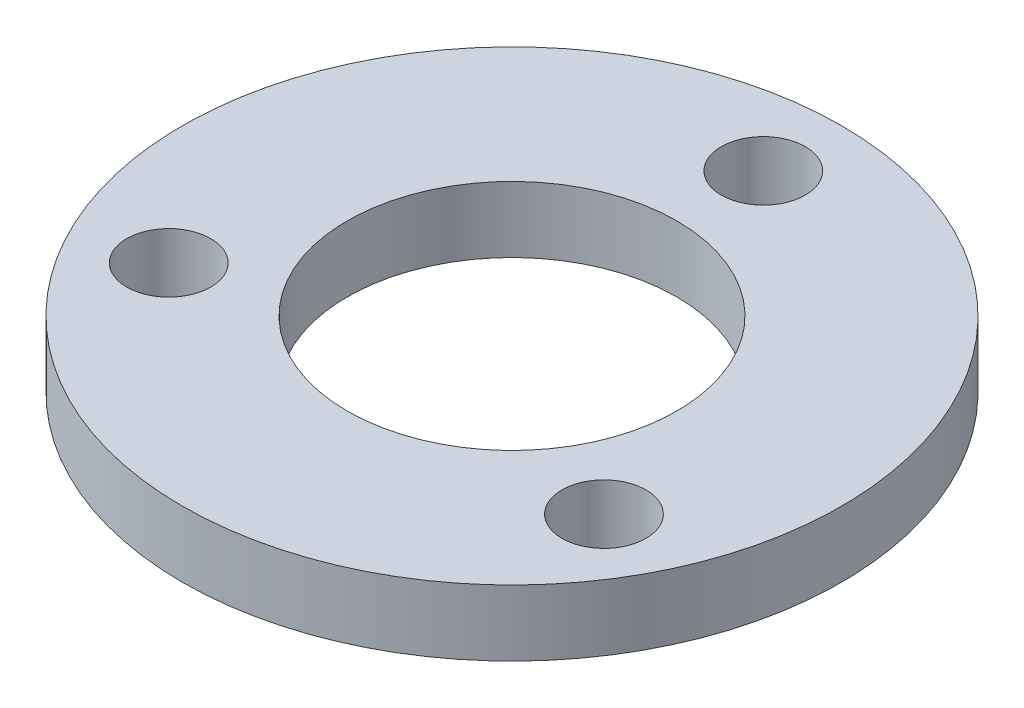
from build123d import *

# Parameters (mm, degrees)
SKETCH1_R           = 20
SKETCH1_R_2         = 10
BOSS_EXTRUDE1_DEPTH = 4
SKETCH2_R           = 2.55
CUT_EXTRUDE2_DEPTH  = 29.565713714
CIRPATTERN1_COUNT   = 3


with BuildPart() as part:
    # Sketch1 → Boss-Extrude1 (new body)
    with BuildSketch(Plane(origin=(0, 0, 0), x_dir=(1, 0, 0), z_dir=(0, 1, 0))):
        Circle(SKETCH1_R)
        Circle(SKETCH1_R_2, mode=Mode.SUBTRACT)
    extrude(amount=BOSS_EXTRUDE1_DEPTH)

    # Sketch2 → Cut-Extrude2 (cut, through all)
    with BuildSketch(Plane(origin=(0, 4, 0), x_dir=(1, 0, 0), z_dir=(0, 1, 0))):
        with Locations((0, 15.25)):
            Circle(SKETCH2_R)
    cut_extrude2 = extrude(amount=-CUT_EXTRUDE2_DEPTH, mode=Mode.SUBTRACT)

    # CirPattern1: Cut-Extrude2 ×3 about axis
    cirpattern1_axis = Axis((0, 4, 0), (0, -1, 0))
    for i in range(1, CIRPATTERN1_COUNT):
        add(cut_extrude2.rotate(cirpattern1_axis, i * 360 / CIRPATTERN1_COUNT), mode=Mode.SUBTRACT)


solid = part.part
